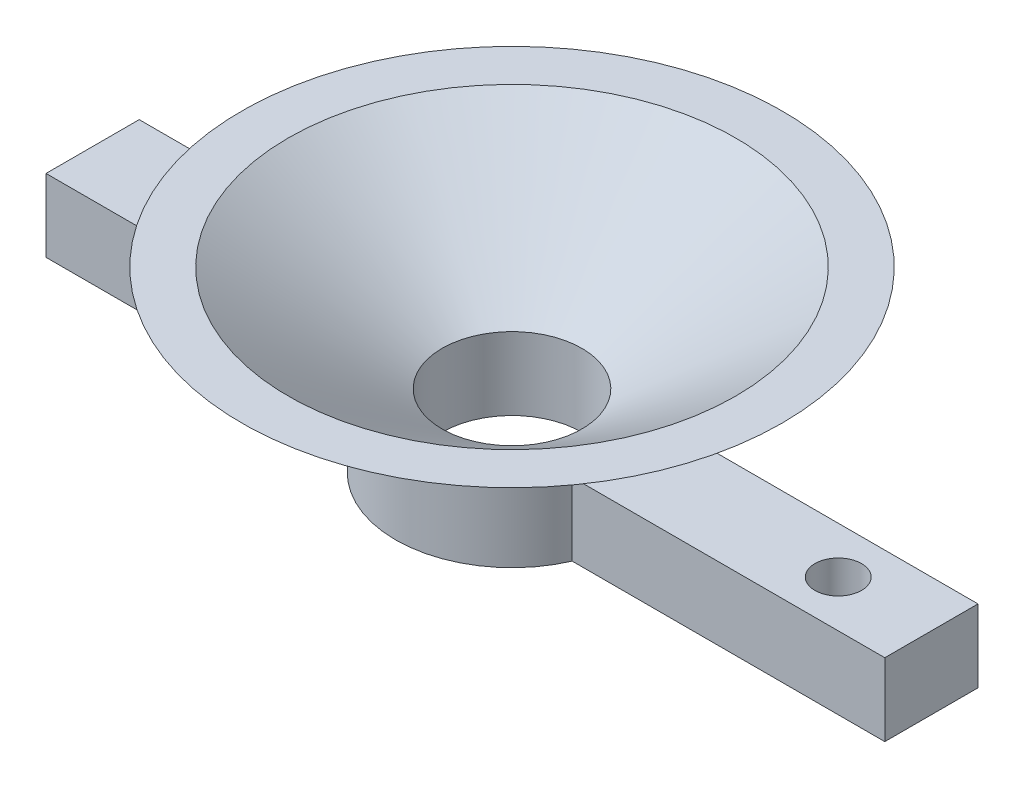
from build123d import *

# Parameters (mm, degrees)
SKETCH1_R           = 0.79375
SKETCH1_R_2         = 2.38125
BOSS_EXTRUDE1_DEPTH = 1.23825


with BuildPart() as part:
    # Sketch1 → Boss-Extrude1 (new, symmetric)
    with BuildSketch(Plane(origin=(0, 0, 0), x_dir=(1, 0, 0), z_dir=(0, 1, 0))):
        with BuildLine():
            Line((-14.2875, 1.5875), (-14.2875, -1.5875))
            Line((-14.2875, -1.5875), (-3.637419458, -1.5875))
            ThreePointArc((-3.637419458, -1.5875), (0, -3.96875), (3.637419458, -1.5875))
            Line((3.637419458, -1.5875), (14.2875, -1.5875))
            Line((14.2875, -1.5875), (14.2875, 1.5875))
            Line((14.2875, 1.5875), (3.637419458, 1.5875))
            ThreePointArc((3.637419458, 1.5875), (0, 3.96875), (-3.637419458, 1.5875))
            Line((-3.637419458, 1.5875), (-14.2875, 1.5875))
        make_face()
        with Locations((-11.1125, 0)):
            Circle(SKETCH1_R, mode=Mode.SUBTRACT)
        Circle(SKETCH1_R_2, mode=Mode.SUBTRACT)
        with Locations((11.1125, 0)):
            Circle(SKETCH1_R, mode=Mode.SUBTRACT)
    extrude(amount=BOSS_EXTRUDE1_DEPTH, both=True)

    # Sketch2 → Revolve2 (revolve)
    with BuildSketch(Plane.XY):
        Polygon((-2.38125, 1.23825), (-7.62, 4.826842821), (-9.2075, 4.826842821), (-3.96875, 1.23825), align=None)
    revolve(axis=Axis((0, -1000, 0), (0, 1, 0)))


solid = part.part
